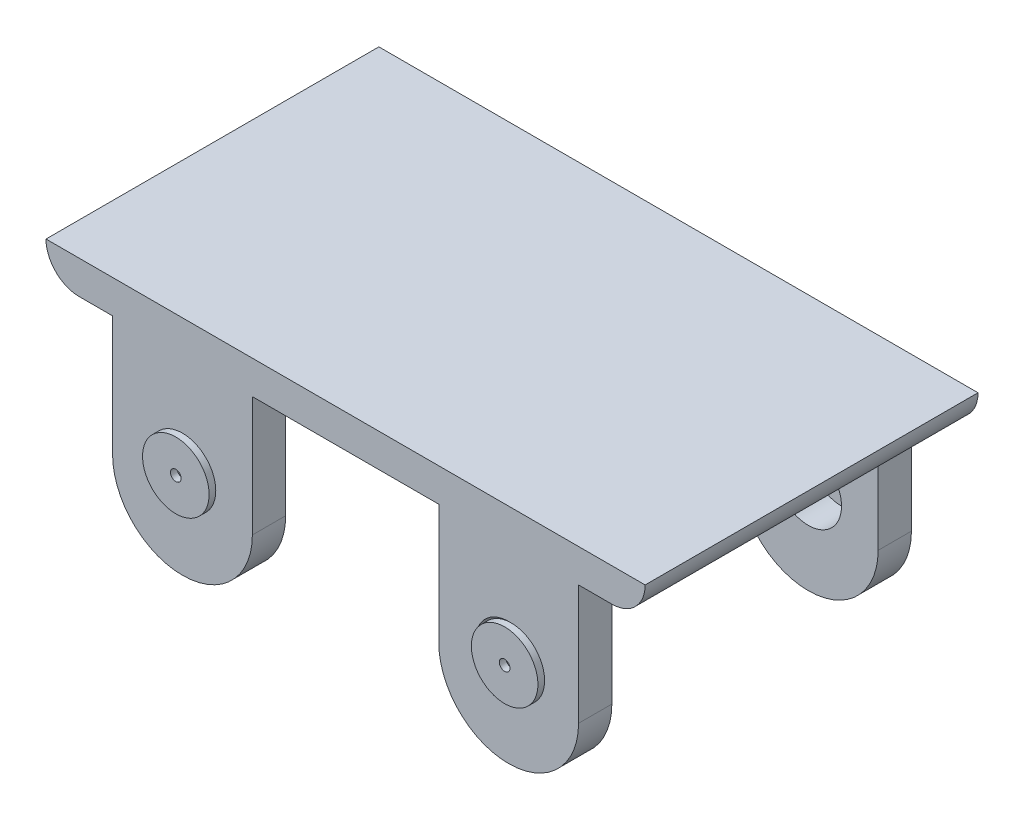
from build123d import *

# Parameters (mm, degrees)
SKETCH1_W           = 90
SKETCH1_H           = 50
BOSS_EXTRUDE1_DEPTH = 5
FILLET6_R           = 5
FILLET7_R           = 5
SKETCH2_R           = 5
BOSS_EXTRUDE3_DEPTH = 5
BOSS_EXTRUDE4_START = -45
BOSS_EXTRUDE4_DEPTH = 5
SKETCH9_R           = 5
BOSS_EXTRUDE5_DEPTH = 1
CUT_EXTRUDE1_START  = -5
SKETCH11_R          = 5
CUT_EXTRUDE1_DEPTH  = 5
SKETCH12_R          = 5
BOSS_EXTRUDE7_DEPTH = 1
CUT_EXTRUDE2_START  = -5
SKETCH14_R          = 5
CUT_EXTRUDE2_DEPTH  = 5
SKETCH16_R          = 0.8
CUT_EXTRUDE6_DEPTH  = 5
SKETCH17_R          = 0.8
CUT_EXTRUDE8_DEPTH  = 5


with BuildPart() as part:
    # Sketch1 → Boss-Extrude1 (new body)
    with BuildSketch(Plane(origin=(0, 0, 0), x_dir=(1, 0, 0), z_dir=(0, 1, 0))):
        with Locations((45, 25)):
            Rectangle(SKETCH1_W, SKETCH1_H)
    extrude(amount=BOSS_EXTRUDE1_DEPTH)

    # Fillet6
    fillet6_edges = [part.edges().sort_by_distance(p)[0] for p in [
        (90, 0, -25),
    ]]
    fillet(fillet6_edges, radius=FILLET6_R - 0.0001)  # a hair under: the kernel refuses the full size

    # Fillet7
    fillet7_edges = [part.edges().sort_by_distance(p)[0] for p in [
        (0, 0, -25),
    ]]
    fillet(fillet7_edges, radius=FILLET7_R - 0.0001)  # a hair under: the kernel refuses the full size

    # Sketch2 → Boss-Extrude3 (add)
    # profile 1 of 4: a face of its own
    with BuildSketch(Plane.XY):
        with BuildLine():
            ThreePointArc((31, -18), (20.5, -28.5), (10, -18))
            Line((10, -18), (10, 0))
            Line((10, 0), (31, 0))
            Line((31, 0), (31, -18))
        make_face()
        with Locations((20.5, -15)):
            Circle(SKETCH2_R, mode=Mode.SUBTRACT)
    # profile 2 of 4: a face of its own
    with BuildSketch(Plane.XY):
        with BuildLine():
            Line((59, -18), (59, 0))
            Line((59, 0), (80, 0))
            Line((80, 0), (80, -18))
            ThreePointArc((80, -18), (69.5, -28.5), (59, -18))
        make_face()
        with Locations((69.5, -15)):
            Circle(SKETCH2_R, mode=Mode.SUBTRACT)
    # profile 3 of 4: a face of its own
    with BuildSketch(Plane.XY):
        with Locations((20.5, -15)):
            Circle(SKETCH2_R)
    # profile 4 of 4: a face of its own
    with BuildSketch(Plane.XY):
        with Locations((69.5, -15)):
            Circle(SKETCH2_R)
    extrude(amount=-BOSS_EXTRUDE3_DEPTH)

    # Sketch7 → Boss-Extrude4 (add)
    with BuildSketch(Plane.XY.offset(BOSS_EXTRUDE4_START)):
        with BuildLine():
            Line((80, 0), (80, -18))
            ThreePointArc((80, -18), (69.5, -28.5), (59, -18))
            Line((59, -18), (59, 0))
            Line((59, 0), (80, 0))
        make_face()
        with BuildLine():
            Line((31, 0), (31, -18))
            ThreePointArc((31, -18), (20.5, -28.5), (10, -18))
            Line((10, -18), (10, 0))
            Line((10, 0), (31, 0))
        make_face()
    extrude(amount=-BOSS_EXTRUDE4_DEPTH)

    # Sketch9 → Boss-Extrude5 (add)
    with BuildSketch(Plane.XY):
        with Locations(Location((20.5, -15, 0), (0, 0, 180))):
            Circle(SKETCH9_R)
        with Locations(Location((69.895831462, -15, 0), (0, 0, 180))):
            Circle(SKETCH9_R)
    extrude(amount=BOSS_EXTRUDE5_DEPTH)

    # Sketch11 → Cut-Extrude1 (cut)
    with BuildSketch(Plane.XY.offset(CUT_EXTRUDE1_START)):
        with Locations((20.5, -15)):
            Circle(SKETCH11_R)
        with Locations(Location((69.5, -15, 0), (0, 0, 272.268539879))):
            Circle(SKETCH11_R)
    extrude(amount=CUT_EXTRUDE1_DEPTH, mode=Mode.SUBTRACT)


with BuildPart() as cut_extrude1_piece_1:
    # of the separate pieces the step leaves, piece 1, a body of its own (cut_extrude1_pieces)
    add(part.part.solids().sort_by_distance((4.9999, 0, 0))[0])

    # Sketch12 → Boss-Extrude7 (add)
    with BuildSketch(Plane.XY.offset(-50)):
        with Locations((20.5, -15)):
            Circle(SKETCH12_R)
        with Locations(Location((69.5, -15, 0), (0, 0, 272.268539879))):
            Circle(SKETCH12_R)
    extrude(amount=-BOSS_EXTRUDE7_DEPTH)

    # Sketch14 → Cut-Extrude2 (cut)
    with BuildSketch(Plane(origin=(0, 0, -50), x_dir=(-1, 0, 0), z_dir=(0, 0, -1)).offset(CUT_EXTRUDE2_START)):
        with Locations(Location((-69.5, -15, 0), (0, 0, 267.731460121))):
            Circle(SKETCH14_R)
        with Locations(Location((-20.5, -15, 0), (0, 0, 180))):
            Circle(SKETCH14_R)
    extrude(amount=CUT_EXTRUDE2_DEPTH, mode=Mode.SUBTRACT)


with BuildPart() as cut_extrude1_piece_2:
    # of the separate pieces the step leaves, piece 2, a body of its own (cut_extrude1_pieces)
    add(part.part.solids().sort_by_distance((15.5, -15, 1))[0])


with BuildPart() as cut_extrude2_piece_1:
    # of the separate pieces the step leaves, piece 1, a body of its own (cut_extrude2_pieces)
    add(cut_extrude1_piece_1.part.solids().sort_by_distance((4.9999, 0, 0))[0])


with BuildPart() as cut_extrude2_piece_2:
    # of the separate pieces the step leaves, piece 2, a body of its own (cut_extrude2_pieces)
    add(cut_extrude1_piece_1.part.solids().sort_by_distance((25.5, -15, -51))[0])


with BuildPart() as cut_extrude2_piece_3:
    # of the separate pieces the step leaves, piece 3, a body of its own (cut_extrude2_pieces)
    add(cut_extrude1_piece_1.part.solids().sort_by_distance((69.697915731, -19.996081401, -51))[0])


with BuildPart() as cut_extrude6_tool:
    # Sketch16 → Cut-Extrude6 (new body)
    with BuildSketch(Plane(origin=(0, 0, -50), x_dir=(-1, 0, 0), z_dir=(0, 0, -1))):
        with Locations(Location((-69.5, -15, 0), (0, 0, 180))):
            Circle(SKETCH16_R)
        with Locations(Location((-20.5, -15, 0), (0, 0, 180))):
            Circle(SKETCH16_R)
    extrude(amount=CUT_EXTRUDE6_DEPTH)


with BuildPart() as cut_extrude2_piece_2_1:
    add(cut_extrude2_piece_2.part)

    # Cut-Extrude6: cut by cut_extrude6_tool
    add(cut_extrude6_tool.part, mode=Mode.SUBTRACT)


with BuildPart() as cut_extrude2_piece_3_1:
    add(cut_extrude2_piece_3.part)

    # Cut-Extrude6: cut by cut_extrude6_tool
    add(cut_extrude6_tool.part, mode=Mode.SUBTRACT)


with BuildPart() as cut_extrude8_tool:
    # Sketch17 → Cut-Extrude8 (new body)
    with BuildSketch(Plane.XY):
        with Locations((20.5, -15)):
            Circle(SKETCH17_R)
        with Locations(Location((69.895831462, -15, 0), (0, 0, 180))):
            Circle(SKETCH17_R)
    extrude(amount=CUT_EXTRUDE8_DEPTH)


with BuildPart() as cut_extrude1_piece_2_1:
    add(cut_extrude1_piece_2.part)

    # Cut-Extrude8: cut by cut_extrude8_tool
    add(cut_extrude8_tool.part, mode=Mode.SUBTRACT)


with BuildPart() as cut_extrude2_piece_1_1:
    add(cut_extrude2_piece_1.part)

    # Cut-Extrude8: cut by cut_extrude8_tool
    add(cut_extrude8_tool.part, mode=Mode.SUBTRACT)


solid = Compound([cut_extrude2_piece_2_1.part, cut_extrude2_piece_3_1.part, cut_extrude1_piece_2_1.part, cut_extrude2_piece_1_1.part])
